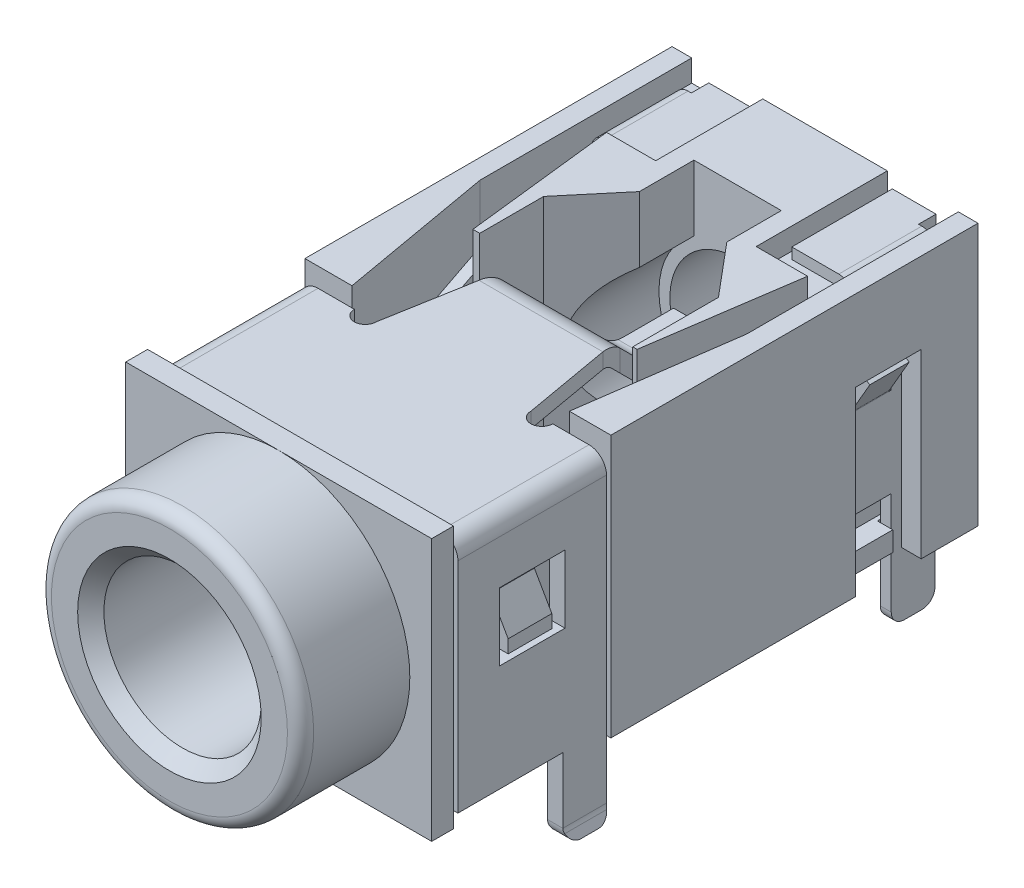
from build123d import *
from OCP.BRepAlgoAPI import BRepAlgoAPI_Cut
from OCP.TopTools import TopTools_ListOfShape

# Parameters (mm, degrees)
BOSS_EXTRUDE1_DEPTH  = 0.5
SKETCH2_W            = 6.1
SKETCH2_H            = 5.3
BOSS_EXTRUDE2_DEPTH  = 3.6
BOSS_EXTRUDE3_DEPTH  = 8.4
CUT_EXTRUDE1_DEPTH   = 0.5
CUT_EXTRUDE2_DEPTH   = 5.55
CUT_EXTRUDE3_DEPTH   = 4.15
SKETCH7_W            = 1.05
SKETCH7_H            = 0.475
SKETCH7_W_2          = 0.85
SKETCH7_H_2          = 1.15
CUT_EXTRUDE4_DEPTH   = 0.45
SKETCH8_W            = 0.85
SKETCH8_H            = 1.15
CUT_EXTRUDE5_DEPTH   = 0.95
CUT_EXTRUDE6_DEPTH   = 8.4
SKETCH10_R           = 0.475
BOSS_EXTRUDE4_DEPTH  = 0.8
FILLET1_R            = 0.2
BOSS_EXTRUDE5_DEPTH  = 1
SKETCH12_R           = 3
BOSS_EXTRUDE6_DEPTH  = 2.5
CUT_EXTRUDE7_REACH   = 17.865
SKETCH13_R           = 1.8
FILLET2_R            = 0.3
CHAMFER1_SIZE        = 0.3
BOSS_EXTRUDE7_DEPTH  = 3.4
BOSS_EXTRUDE8_DEPTH  = 1
SKETCH17_W           = 1.5
SKETCH17_H           = 1.55
CUT_EXTRUDE8_DEPTH   = 0.35
BOSS_EXTRUDE9_DEPTH  = 1.77
CUT_EXTRUDE9_DEPTH   = 3
FILLET3_R            = 0.3
SKETCH20_W           = 0.25
SKETCH20_H           = 7
BOSS_EXTRUDE10_DEPTH = 2.4
SKETCH21_W           = 1.4
SKETCH21_H           = 2.65
CUT_EXTRUDE10_DEPTH  = 0.25
BOSS_EXTRUDE11_DEPTH = 4.35
CUT_EXTRUDE11_DEPTH  = 2
BOSS_EXTRUDE12_DEPTH = 1.9
SKETCH26_W           = 1.000000003
SKETCH26_H           = 0.25
BOSS_EXTRUDE13_DEPTH = 0.4
BOSS_EXTRUDE14_DEPTH = 0.45
FILLET4_R            = 0.3
BOSS_EXTRUDE15_DEPTH = 1.6
CUT_EXTRUDE12_DEPTH  = 2.25
CUT_EXTRUDE13_DEPTH  = 2.25


with BuildPart() as part:
    # Sketch1 → Boss-Extrude1 (new body)
    with BuildSketch(Plane.XY):
        Polygon((-3.5, -3), (0, -3), (3.5, -3), (3.5, 3), (0, 3), (-3.5, 3), align=None)
    extrude(amount=-BOSS_EXTRUDE1_DEPTH)

    # Sketch2 → Boss-Extrude2 (add)
    with BuildSketch(Plane(origin=(0, 0, -0.5), x_dir=(-1, 0, 0), z_dir=(0, 0, -1))):
        with Locations((0, -0.35)):
            Rectangle(SKETCH2_W, SKETCH2_H)
    extrude(amount=BOSS_EXTRUDE2_DEPTH)

    # Sketch3 → Boss-Extrude3 (add)
    with BuildSketch(Plane(origin=(0, 0, -4.1), x_dir=(-1, 0, 0), z_dir=(0, 0, -1))):
        Polygon((-3.5, -3), (-3.05, -3), (3.05, -3), (3.5, -3), (3.5, 3), (2.55, 3), (-2.42268417, 3), (-3.5, 3), align=None)
    extrude(amount=BOSS_EXTRUDE3_DEPTH)

    # Sketch4 → Cut-Extrude1 (cut)
    with BuildSketch(Plane(origin=(0, 3, 0), x_dir=(1, 0, 0), z_dir=(0, 1, 0))):
        Polygon((2.6, 9.5), (2.6, 11.95), (2.7, 11.95), (2.7, 12.05), (3.05, 12.05), (3.05, 12.5), (1.425, 12.5), (1.425, 9.5), align=None)
        Polygon((-3.05, 12.5), (-3.05, 12.05), (-2.7, 12.05), (-2.7, 11.95), (-2.548863636, 11.95), (-2.548863636, 10.05), (-1.425, 10.05), (-1.425, 12.5), align=None)
    extrude(amount=-CUT_EXTRUDE1_DEPTH, mode=Mode.SUBTRACT)

    # Sketch5 → Cut-Extrude2 (cut)
    with BuildSketch(Plane(origin=(0, 3, 0), x_dir=(1, 0, 0), z_dir=(0, 1, 0))):
        Polygon((-2.42268417, 4.1), (-3.05, 7.657684861), (-3.05, 12.05), (-2.7, 12.05), (-2.7, 11.95), (-2.548863636, 11.95), (-2.548863636, 10.05), (-2.156818182, 6.6), (-2, 6.6), (-2, 8.061649281), (-1, 9.253402874), (-1, 10.5), (1, 10.5), (1, 9.253402874), (2, 8.061649281), (2, 6.1), (2.1, 6.1), (2.6, 9.5), (2.6, 11.95), (2.7, 11.95), (2.7, 12.05), (3.05, 12.05), (3.05, 7.657684861), (2.55, 4.1), align=None)
    extrude(amount=-CUT_EXTRUDE2_DEPTH, mode=Mode.SUBTRACT)

    # Sketch6 → Cut-Extrude3 (cut)
    with BuildSketch(Plane.XZ.offset(3)):
        Polygon((-3.05, -11.2), (-3.5, -11.2), (-3.5, -9.7), (-3.05, -9.7), (-3.05, -11), (-2.7, -11), (-2.7, -12.05), (-3.05, -12.05), align=None)
        Polygon((3.5, -11.2), (3.05, -11.2), (3.05, -12.05), (2.7, -12.05), (2.7, -11), (3.05, -11), (3.05, -9.7), (3.5, -9.7), align=None)
    extrude(amount=-CUT_EXTRUDE3_DEPTH, mode=Mode.SUBTRACT)

    # Sketch7 → Cut-Extrude4 (cut)
    with BuildSketch(Plane.XZ.offset(3)):
        with Locations((0.015, -12.2625)):
            Rectangle(SKETCH7_W, SKETCH7_H)
        with Locations((1.325, -9.1)):
            Rectangle(SKETCH7_W_2, SKETCH7_H_2)
        with Locations((-1.325, -9.1)):
            Rectangle(SKETCH7_W_2, SKETCH7_H_2)
    extrude(amount=-CUT_EXTRUDE4_DEPTH, mode=Mode.SUBTRACT)

    # Sketch8 → Cut-Extrude5 (cut)
    with BuildSketch(Plane.XZ.offset(3)):
        with Locations((1.325, -9.1)):
            Rectangle(SKETCH8_W, SKETCH8_H)
        with Locations((-1.325, -9.1)):
            Rectangle(SKETCH8_W, SKETCH8_H)
    extrude(amount=-CUT_EXTRUDE5_DEPTH, mode=Mode.SUBTRACT)

    # Sketch9 → Cut-Extrude6 (cut)
    with BuildSketch(Plane(origin=(0, 0, -12.5), x_dir=(-1, 0, 0), z_dir=(0, 0, -1))):
        with BuildLine():
            Line((1.75, -2.05), (1.75, -2.55))
            Line((1.75, -2.55), (0.54, -2.55))
            Line((0.54, -2.55), (-0.51, -2.55))
            Line((-0.51, -2.55), (-1.75, -2.55))
            Line((-1.75, -2.55), (-1.75, -2.05))
            Line((-1.75, -2.05), (-1.2, -2.05))
            Line((-1.2, -2.05), (-1.2, -1.35))
            Line((-1.2, -1.35), (-0.761577311, -1.35))
            ThreePointArc((-0.761577311, -1.35), (-1.33845897, -0.781682534), (-1.55, 0))
            ThreePointArc((-1.55, 0), (0, 1.55), (1.55, 0))
            ThreePointArc((1.55, 0), (1.33845897, -0.781682534), (0.761577311, -1.35))
            Line((0.761577311, -1.35), (1.2, -1.35))
            Line((1.2, -1.35), (1.2, -2.05))
            Line((1.2, -2.05), (1.75, -2.05))
        make_face()
    extrude(amount=-CUT_EXTRUDE6_DEPTH, mode=Mode.SUBTRACT)

    # Sketch10 → Boss-Extrude4 (add)
    with BuildSketch(Plane.XZ.offset(3)):
        with Locations(Location((0, -2, 0), (0, 0, 270))):
            Circle(SKETCH10_R)
        with Locations(Location((0, -9, 0), (0, 0, 270))):
            Circle(SKETCH10_R)
    extrude(amount=BOSS_EXTRUDE4_DEPTH)

    # Fillet1
    fillet1_edges = [part.edges().sort_by_distance(p)[0] for p in [
        (0, -3.8, -1.525),
        (0, -3.8, -8.525),
    ]]
    fillet(fillet1_edges, radius=FILLET1_R)

    # Sketch11 → Boss-Extrude5 (add)
    with BuildSketch(Plane.XY.offset(-1.8)):
        Polygon((-3.45, -0.209568124), (-3.05, -0.209568124), (-3.05, 0.790431876), (-3.45, 0.090431876), align=None)
        Polygon((3.05, -0.209568124), (3.45, -0.209568124), (3.45, 0.090431876), (3.05, 0.790431876), align=None)
    extrude(amount=-BOSS_EXTRUDE5_DEPTH)

    # Sketch12 → Boss-Extrude6 (add)
    with BuildSketch(Plane.XY):
        with Locations(Location((0, 0, 0), (0, 0, 270))):
            Circle(SKETCH12_R)
    extrude(amount=BOSS_EXTRUDE6_DEPTH)

    # Cut-Extrude7: up to this face of the body (flat: up to its plane)
    cut_extrude7_end = Plane(part.part.faces().sort_by_distance((0, 2.213607678, -10.5))[0])
    # Sketch13 → Cut-Extrude7 (cut, up to the picked face)
    with BuildSketch(Plane.XY.offset(2.5), mode=Mode.PRIVATE) as cut_extrude7_sk1:
        Circle(SKETCH13_R)
    cut_extrude7_tool1 = split(extrude(cut_extrude7_sk1.sketch, amount=-CUT_EXTRUDE7_REACH, mode=Mode.PRIVATE), bisect_by=cut_extrude7_end, keep=Keep.BOTH, mode=Mode.PRIVATE)
    add(cut_extrude7_tool1.solids().sort_by(Axis((0, 0, 2.5), (0, 0, -1)))[0], mode=Mode.SUBTRACT)

    # Fillet2
    fillet2_edges = [part.edges().sort_by_distance(p)[0] for p in [
        (0, 3, 2.5),
    ]]
    fillet(fillet2_edges, radius=FILLET2_R)

    # Chamfer1
    chamfer1_edges = [part.edges().sort_by_distance(p)[0] for p in [
        (-1.8, 0, 2.5),
    ]]
    chamfer(chamfer1_edges, length=CHAMFER1_SIZE)


with BuildPart() as body_2:
    # Sketch15 → Boss-Extrude7 (new body)
    with BuildSketch(Plane.XY.offset(-0.6)):
        with BuildLine():
            Line((-3.5, -2.439999997), (-3.5, -2.739999997))
            Line((-3.5, -2.739999997), (-3.15, -2.739999997))
            Line((-3.15, -2.739999997), (-3.15, -2.439999997))
            Line((-3.15, -2.439999997), (-3.15, 2.26))
            ThreePointArc((-3.15, 2.26), (-3.135355339, 2.295355339), (-3.1, 2.31))
            Line((-3.1, 2.31), (3.1, 2.31))
            ThreePointArc((3.1, 2.31), (3.135355339, 2.295355339), (3.15, 2.26))
            Line((3.15, 2.26), (3.15, -2.439999997))
            Line((3.15, -2.439999997), (3.15, -2.739999997))
            Line((3.15, -2.739999997), (3.5, -2.739999997))
            Line((3.5, -2.739999997), (3.5, -2.439999997))
            Line((3.5, -2.439999997), (3.5, 2.26))
            ThreePointArc((3.5, 2.26), (3.382842712, 2.542842712), (3.1, 2.66))
            Line((3.1, 2.66), (-3.1, 2.66))
            ThreePointArc((-3.1, 2.66), (-3.382842712, 2.542842712), (-3.5, 2.26))
            Line((-3.5, 2.26), (-3.5, -2.439999997))
        make_face()
    extrude(amount=-BOSS_EXTRUDE7_DEPTH)

    # Sketch16 → Boss-Extrude8 (add)
    with BuildSketch(Plane(origin=(0, 0, -4), x_dir=(-1, 0, 0), z_dir=(0, 0, -1))):
        with BuildLine():
            Line((3.15, -2.739999997), (3.15, -4.24))
            ThreePointArc((3.15, -4.24), (3.164222396, -4.369863768), (3.206215328, -4.493570957))
            Line((3.206215328, -4.493570957), (3.227865546, -4.54))
            Line((3.227865546, -4.54), (3.614047818, -4.54))
            Line((3.614047818, -4.54), (3.523423053, -4.345654565))
            ThreePointArc((3.523423053, -4.345654565), (3.505925998, -4.294109903), (3.5, -4.24))
            Line((3.5, -4.24), (3.5, -2.739999997))
            Line((3.5, -2.739999997), (3.15, -2.739999997))
        make_face()
        with BuildLine():
            Line((-3.5, -2.739999997), (-3.15, -2.739999997))
            Line((-3.15, -2.739999997), (-3.15, -4.24))
            ThreePointArc((-3.15, -4.24), (-3.164222396, -4.369863768), (-3.206215328, -4.493570957))
            Line((-3.206215328, -4.493570957), (-3.227865546, -4.54))
            Line((-3.227865546, -4.54), (-3.614047818, -4.54))
            Line((-3.614047818, -4.54), (-3.523423053, -4.345654565))
            ThreePointArc((-3.523423053, -4.345654565), (-3.505925998, -4.294109903), (-3.5, -4.24))
            Line((-3.5, -4.24), (-3.5, -2.739999997))
        make_face()
    extrude(amount=-BOSS_EXTRUDE8_DEPTH)

    # Sketch17 → Cut-Extrude8 (cut)
    with BuildSketch(Plane.ZY.offset(-3.15)):
        with Locations((-2.3, 0.475431876)):
            Rectangle(SKETCH17_W, SKETCH17_H)
    cut_extrude8 = extrude(amount=-CUT_EXTRUDE8_DEPTH, mode=Mode.SUBTRACT)

    # Mirror1: Cut-Extrude8 across plane
    add(cut_extrude8.mirror(Plane(origin=(0, 0, 0), x_dir=(0, 0, 1), z_dir=(1, 0, 0))), mode=Mode.SUBTRACT)

    # Sketch18 → Boss-Extrude9 (add, symmetric)
    with BuildSketch(Plane(origin=(0, 0, 0), x_dir=(0, 0, -1), z_dir=(1, 0, 0))):
        with BuildLine():
            Line((4, 2.66), (4, 2.31))
            Line((4, 2.31), (6, 2.31))
            ThreePointArc((6, 2.31), (6.11480503, 2.28716386), (6.212132034, 2.222132034))
            Line((6.212132034, 2.222132034), (8.079034026, 0.355230043))
            ThreePointArc((8.079034026, 0.355230043), (8.30613037, 0.203489117), (8.574008773, 0.150204789))
            Line((8.574008773, 0.150204789), (8.648412492, 0.150204789))
            Line((8.648412492, 0.150204789), (9.833988579, 0.150204789))
            Line((9.833988579, 0.150204789), (9.833988579, 0.500204789))
            Line((9.833988579, 0.500204789), (8.648412492, 0.500204789))
            Line((8.648412492, 0.500204789), (8.574008773, 0.500204789))
            ThreePointArc((8.574008773, 0.500204789), (8.440069572, 0.526846953), (8.3265214, 0.602717416))
            Line((8.3265214, 0.602717416), (6.459619408, 2.469619408))
            ThreePointArc((6.459619408, 2.469619408), (6.248744231, 2.610521696), (6, 2.66))
            Line((6, 2.66), (4, 2.66))
        make_face()
    extrude(amount=BOSS_EXTRUDE9_DEPTH, both=True)

    # Sketch19 → Cut-Extrude9 (cut)
    with BuildSketch(Plane(origin=(0, 2.66, 0), x_dir=(1, 0, 0), z_dir=(0, 1, 0))):
        with BuildLine():
            Line((-0.8, 9.833988579), (0.8, 9.833988579))
            Line((0.8, 9.833988579), (0.8, 8.648412492))
            Line((0.8, 8.648412492), (0.813119383, 8.574008773))
            add(Edge.make_bspline(
                [(0.885824999, 8.3265214), (0.861589794, 8.391313442), (0.837354588, 8.482378987), (0.813119383, 8.574008773)],
                knots=[0, 0, 0, 0, 1, 1, 1, 1], degree=3))
            Line((0.885824999, 8.3265214), (1.351363161, 6.459619408))
            add(Edge.make_bspline(
                [(1.417144432, 6), (1.411637232, 6.042739739), (1.400636535, 6.12804229), (1.384253797, 6.25033289), (1.367871058, 6.363091521), (1.356870362, 6.429397848), (1.351363161, 6.459619408)],
                knots=[0, 0, 0, 0, 0.25, 0.5, 0.75, 1, 1, 1, 1], degree=3, weights=[1, 1, 1, 1, 1, 1, 1]))
            Line((1.417144432, 6), (1.769798394, 4))
            ThreePointArc((1.769798394, 4), (1.843021699, 3.823223305), (2.019798394, 3.75))
            ThreePointArc((2.019798394, 3.75), (2.196575089, 3.823223305), (2.269798394, 4))
            Line((2.269798394, 4), (2.269798394, 10.031115329))
            Line((2.269798394, 10.031115329), (-2.269798394, 10.031115329))
            Line((-2.269798394, 10.031115329), (-2.269798394, 4))
            ThreePointArc((-2.269798394, 4), (-2.196575089, 3.823223305), (-2.019798394, 3.75))
            ThreePointArc((-2.019798394, 3.75), (-1.843021699, 3.823223305), (-1.769798394, 4))
            Line((-1.769798394, 4), (-1.417144432, 6))
            add(Edge.make_bspline(
                [(-1.351363161, 6.459619408), (-1.356870362, 6.429397848), (-1.367871058, 6.363091521), (-1.384253796, 6.250332898), (-1.400636535, 6.128042291), (-1.411637232, 6.042739739), (-1.417144432, 6)],
                knots=[0, 0, 0, 0, 0.25, 0.5, 0.75, 1, 1, 1, 1], degree=3, weights=[1, 1, 1, 1, 1, 1, 1]))
            Line((-1.351363161, 6.459619408), (-0.885824999, 8.3265214))
            add(Edge.make_bspline(
                [(-0.813119383, 8.574008773), (-0.837354589, 8.482378987), (-0.861589794, 8.391313442), (-0.885824999, 8.3265214)],
                knots=[0, 0, 0, 0, 1, 1, 1, 1], degree=3))
            Line((-0.813119383, 8.574008773), (-0.8, 8.648412493))
            Line((-0.8, 8.648412493), (-0.8, 9.833988579))
        make_face()
    extrude(amount=-CUT_EXTRUDE9_DEPTH, mode=Mode.SUBTRACT)

    # Fillet3
    fillet3_edges = [body_2.edges().sort_by_distance(p)[0] for p in [
        (-3.420956682, -4.54, -3),
        (-3.420956682, -4.54, -4),
        (3.420956682, -4.54, -3),
        (3.420956682, -4.54, -4),
    ]]
    fillet(fillet3_edges, radius=FILLET3_R)


with BuildPart() as body_3:
    # Sketch20 → Boss-Extrude10 (new body)
    with BuildSketch(Plane(origin=(0, 0, -12.04), x_dir=(-1, 0, 0), z_dir=(0, 0, -1))):
        with Locations((2.85, -1.04)):
            Rectangle(SKETCH20_W, SKETCH20_H)
    extrude(amount=-BOSS_EXTRUDE10_DEPTH)

    # Sketch21 → Cut-Extrude10 (cut)
    with BuildSketch(Plane.ZY.offset(2.975)):
        with Locations((-10.34, -3.215)):
            Rectangle(SKETCH21_W, SKETCH21_H)
        Polygon((-11.04, 0.16), (-10.99, 0.16), (-10.09, 0.16), (-10.04, 0.16), (-10.04, 1.36), (-11.04, 1.36), align=None)
    extrude(amount=-CUT_EXTRUDE10_DEPTH, mode=Mode.SUBTRACT)

    # Sketch23 → Boss-Extrude11 (add)
    with BuildSketch(Plane(origin=(0, 2.46, 0), x_dir=(1, 0, 0), z_dir=(0, 1, 0))):
        with BuildLine():
            Line((-1.539299429, 3.622167626), (-1.433644863, 3.395590679))
            ThreePointArc((-1.433644863, 3.395590679), (-1.06082018, 3.928039508), (-1.33552205, 4.51713957))
            Line((-1.33552205, 4.51713957), (-1.990843685, 4.976000719))
            ThreePointArc((-1.990843685, 4.976000719), (-2.12575119, 5.116926937), (-2.196459344, 5.298752652))
            Line((-2.196459344, 5.298752652), (-2.717403877, 8.253175911))
            add(Edge.make_bspline(
                [(-2.725, 8.34), (-2.724996883, 8.296253858), (-2.717403877, 8.253175911)],
                knots=[6.193560768, 6.193560768, 6.193560768, 6.360468763, 6.360468763, 6.360468763], degree=2, weights=[1, 0.996519736, 1]))
            Line((-2.725, 8.34), (-2.725, 9.64))
            Line((-2.725, 9.64), (-2.975, 9.64))
            Line((-2.975, 9.64), (-2.975000331, 8.34))
            ThreePointArc((-2.975000331, 8.34), (-2.972146354, 8.274633164), (-2.963606141, 8.209763809))
            Line((-2.963606141, 8.209763809), (-2.442661282, 5.255340608))
            ThreePointArc((-2.442661282, 5.255340608), (-2.336599051, 4.982602035), (-2.134237794, 4.771212708))
            Line((-2.134237794, 4.771212708), (-1.478916159, 4.312351559))
            ThreePointArc((-1.478916159, 4.312351559), (-1.309868854, 3.949828444), (-1.539299429, 3.622167626))
        make_face()
    extrude(amount=-BOSS_EXTRUDE11_DEPTH)


with BuildPart() as cut_extrude11_tool:
    # Sketch24 → Cut-Extrude11 (new body)
    with BuildSketch(Plane.ZY.offset(2.975)):
        with BuildLine():
            Line((-9.64, -1.865), (-8.34, -1.645131356))
            add(Edge.make_bspline(
                [(-8.34, -1.645131356), (-8.296363535, -1.638993311), (-8.252734953, -1.632813272), (-8.209763809, -1.626682484)],
                knots=[0, 0, 0, 0, 1, 1, 1, 1], degree=3, weights=[1, 1, 1, 1]))
            Line((-8.209763809, -1.626682484), (-5.255340608, -1.119292987))
            add(Edge.make_bspline(
                [(-5.255340608, -1.119292987), (-5.206716821, -1.112334161), (-5.111423074, -1.098442024), (-4.980034545, -1.077782308), (-4.864050984, -1.05712259), (-4.799532406, -1.043230454), (-4.771212708, -1.036271627)],
                knots=[0, 0, 0, 0, 0.25, 0.5, 0.75, 1, 1, 1, 1], degree=3, weights=[1, 1, 1, 1, 1, 1, 1]))
            Line((-4.771212708, -1.036271627), (-4.312351559, -0.900967847))
            add(Edge.make_bspline(
                [(-4.312351559, -0.900967847), (-4.294538464, -0.894073917), (-4.252968805, -0.880287533), (-4.176153608, -0.859618509), (-4.085471796, -0.838102735), (-4.019577031, -0.823478099), (-3.984708344, -0.81573723)],
                knots=[0, 0, 0, 0, 0.111111111, 0.222222222, 0.333333333, 0.458197154, 0.458197154, 0.458197154, 0.458197154], degree=3, weights=[1, 1, 1, 1, 1, 1, 1]))
            add(Edge.make_bspline(
                [(-3.395590679, -0.715), (-3.414754767, -0.721194486), (-3.461691116, -0.733577857), (-3.554480161, -0.752071346), (-3.666103348, -0.770612323), (-3.79190322, -0.789190849), (-3.900828874, -0.804275626), (-3.965610802, -0.813127834), (-3.984708344, -0.81573723)],
                knots=[0, 0, 0, 0, 0.1, 0.2, 0.3, 0.4, 0.5, 0.541821305, 0.541821305, 0.541821305, 0.541821305], degree=3, weights=[1, 1, 1, 1, 1, 1, 1, 1, 1]))
            Line((-3.395590679, -0.715), (-3.395590679, -2.13164712))
            Line((-3.395590679, -2.13164712), (-9.64, -2.13164712))
            Line((-9.64, -2.13164712), (-9.64, -1.865))
        make_face()
        with BuildLine():
            Line((-4.312351559, 1.051823432), (-4.771212708, 1.245954944))
            add(Edge.make_bspline(
                [(-4.771212708, 1.245954944), (-4.799534057, 1.255939929), (-4.864054629, 1.275872465), (-4.980034748, 1.305513742), (-5.111418529, 1.335155026), (-5.206713986, 1.355087562), (-5.255340608, 1.365072547)],
                knots=[0, 0, 0, 0, 0.25, 0.5, 0.75, 1, 1, 1, 1], degree=3, weights=[1, 1, 1, 1, 1, 1, 1]))
            Line((-5.255340608, 1.365072547), (-8.209763809, 2.093065715))
            add(Edge.make_bspline(
                [(-8.209763809, 2.093065715), (-8.252740577, 2.101873142), (-8.296365133, 2.110739317), (-8.34, 2.119535836)],
                knots=[0, 0, 0, 0, 1, 1, 1, 1], degree=3, weights=[1, 1, 1, 1]))
            Line((-8.34, 2.119535836), (-9.64, 2.435))
            Line((-9.64, 2.435), (-9.64, 2.652707983))
            Line((-9.64, 2.652707983), (-3.395590679, 2.652707983))
            Line((-3.395590679, 2.652707983), (-3.395590679, 0.785))
            add(Edge.make_bspline(
                [(-3.395590679, 0.785), (-3.414350679, 0.793700337), (-3.46030325, 0.811175631), (-3.552305394, 0.837617667), (-3.663776984, 0.864287116), (-3.79033686, 0.891135316), (-3.899906729, 0.912910713), (-3.965314558, 0.925733149), (-3.984697982, 0.929532802)],
                knots=[0, 0, 0, 0, 0.1, 0.2, 0.3, 0.4, 0.5, 0.542086432, 0.542086432, 0.542086432, 0.542086432], degree=3, weights=[1, 1, 1, 1, 1, 1, 1, 1, 1]))
            add(Edge.make_bspline(
                [(-3.984697982, 0.929532802), (-3.98856391, 0.930764171), (-4.023455478, 0.941877525), (-4.089094781, 0.962858211), (-4.176221015, 0.992521295), (-4.252958617, 1.022148341), (-4.294535488, 1.041930489), (-4.312351559, 1.051823432)],
                knots=[0.541711188, 0.541711188, 0.541711188, 0.541711188, 0.555555556, 0.666666667, 0.777777778, 0.888888889, 1, 1, 1, 1], degree=3, weights=[1, 1, 1, 1, 1, 1, 1, 1]))
        make_face()
    extrude(amount=-CUT_EXTRUDE11_DEPTH)


with BuildPart() as body_3_1:
    add(body_3.part)

    # Cut-Extrude11: cut by cut_extrude11_tool, with a tolerance
    cut_extrude11_stock = TopTools_ListOfShape()
    cut_extrude11_stock.Append(body_3_1.part.wrapped)
    cut_extrude11_tools = TopTools_ListOfShape()
    cut_extrude11_tools.Append(cut_extrude11_tool.part.wrapped)
    cut_extrude11_cut = BRepAlgoAPI_Cut()
    cut_extrude11_cut.SetArguments(cut_extrude11_stock)
    cut_extrude11_cut.SetTools(cut_extrude11_tools)
    cut_extrude11_cut.SetFuzzyValue(0.00001)
    cut_extrude11_cut.Build()
    add(Compound.cast(cut_extrude11_cut.Shape()).solids(), mode=Mode.REPLACE)

    # Sketch25 → Boss-Extrude12 (add)
    with BuildSketch(Plane(origin=(0, 0, -12.04), x_dir=(-1, 0, 0), z_dir=(0, 0, -1))):
        with BuildLine():
            Line((2.599999999, 2.76), (1.599999996, 2.76))
            Line((1.599999996, 2.76), (1.599999996, 2.51))
            Line((1.599999996, 2.51), (2.599999999, 2.51))
            Line((2.599999999, 2.51), (2.675, 2.51))
            ThreePointArc((2.675, 2.51), (2.710355339, 2.495355339), (2.725, 2.46))
            Line((2.725, 2.46), (2.975, 2.46))
            ThreePointArc((2.975, 2.46), (2.887132034, 2.672132034), (2.675, 2.76))
            Line((2.675, 2.76), (2.599999999, 2.76))
        make_face()
    extrude(amount=-BOSS_EXTRUDE12_DEPTH)

    # Sketch26 → Boss-Extrude13 (add)
    with BuildSketch(Plane(origin=(0, 0, -12.04), x_dir=(-1, 0, 0), z_dir=(0, 0, -1))):
        with Locations((2.099999998, 2.635)):
            Rectangle(SKETCH26_W, SKETCH26_H)
    extrude(amount=BOSS_EXTRUDE13_DEPTH)

    # Sketch27 → Boss-Extrude14 (add, symmetric)
    with BuildSketch(Plane(origin=(0, 0, -10.54), x_dir=(-1, 0, 0), z_dir=(0, 0, -1))):
        with BuildLine():
            Line((3.435883837, 0.971671682), (2.98169873, 0.185))
            ThreePointArc((2.98169873, 0.185), (2.976703709, 0.172940952), (2.975, 0.16))
            Line((2.975, 0.16), (2.725, 0.16))
            ThreePointArc((2.725, 0.16), (2.735222252, 0.237645714), (2.765192379, 0.31))
            Line((2.765192379, 0.31), (3.219377486, 1.096671682))
            Line((3.219377486, 1.096671682), (3.435883837, 0.971671682))
        make_face()
    extrude(amount=BOSS_EXTRUDE14_DEPTH, both=True)

    # Fillet4
    fillet4_edges = [body_3_1.edges().sort_by_distance(p)[0] for p in [
        (-2.85, -4.54, -11.04),
        (-2.85, -4.54, -12.04),
    ]]
    fillet(fillet4_edges, radius=FILLET4_R)


with BuildPart() as body_4:
    # Mirror2: mirrored copy
    add(body_3_1.part.mirror(Plane(origin=(0, 0, 0), x_dir=(0, 0, 1), z_dir=(1, 0, 0))))


with BuildPart() as body_5:
    # Sketch28 → Boss-Extrude15 (new, symmetric)
    with BuildSketch(Plane(origin=(0, 0, 0), x_dir=(0, 0, -1), z_dir=(1, 0, 0))):
        with BuildLine():
            Line((12.175, -4.54), (12.175, -2.59))
            ThreePointArc((12.175, -2.59), (12.160355339, -2.554644661), (12.125, -2.54))
            Line((12.125, -2.54), (9.525, -2.54))
            Line((9.525, -2.54), (8.425, -2.54))
            Line((8.425, -2.54), (7.425, -2.539999511))
            ThreePointArc((7.425, -2.539999511), (7.329493587, -2.531643783), (7.236889088, -2.506830482))
            Line((7.236889088, -2.506830482), (4.251817164, -1.420353675))
            Line((4.251817164, -1.420353675), (2.593250665, -0.816684837))
            ThreePointArc((2.593250665, -0.816684837), (2.210931464, -0.833377254), (1.952394284, -1.115521073))
            Line((1.952394284, -1.115521073), (1.717471129, -1.030016036))
            ThreePointArc((1.717471129, -1.030016036), (2.105276899, -0.606800306), (2.678755701, -0.581761682))
            Line((2.678755701, -0.581761682), (4.337322199, -1.185430519))
            Line((4.337322199, -1.185430519), (7.322393957, -2.271907786))
            ThreePointArc((7.322393957, -2.271907786), (7.372905547, -2.285442326), (7.425, -2.29))
            Line((7.425, -2.29), (8.425, -2.29))
            Line((8.425, -2.29), (9.525, -2.29))
            Line((9.525, -2.29), (12.125, -2.29))
            ThreePointArc((12.125, -2.29), (12.337132034, -2.377867966), (12.425, -2.59))
            Line((12.425, -2.59), (12.425, -4.54))
            Line((12.425, -4.54), (12.175, -4.54))
        make_face()
    extrude(amount=BOSS_EXTRUDE15_DEPTH, both=True)

    # Sketch29 → Cut-Extrude12 (cut)
    with BuildSketch(Plane(origin=(0, -2.29, 0), x_dir=(1, 0, 0), z_dir=(0, 1, 0))):
        with BuildLine():
            Line((0.9, 12.125), (1.6, 12.125))
            Line((1.6, 12.125), (1.6, 12.425))
            Line((1.6, 12.425), (0.5, 12.425))
            Line((0.5, 12.425), (0.5, 12.125))
            ThreePointArc((0.5, 12.125), (0.558578644, 11.983578644), (0.7, 11.925))
            ThreePointArc((0.7, 11.925), (0.841421356, 11.983578644), (0.9, 12.125))
        make_face()
        with BuildLine():
            Line((-1.6, 12.125), (-0.9, 12.125))
            ThreePointArc((-0.9, 12.125), (-0.841421356, 11.983578644), (-0.7, 11.925))
            ThreePointArc((-0.7, 11.925), (-0.558578644, 11.983578644), (-0.5, 12.125))
            Line((-0.5, 12.125), (-0.5, 12.425))
            Line((-0.5, 12.425), (-1.6, 12.425))
            Line((-1.6, 12.425), (-1.6, 12.125))
        make_face()
        Polygon((1, 9.525), (0.9, 9.525), (0.9, 8.425), (1.6, 8.425), (1.6, 9.525), align=None)
        Polygon((-1.6, 8.425), (-0.9, 8.425), (-0.9, 9.525), (-1, 9.525), (-1.6, 9.525), align=None)
    extrude(amount=-CUT_EXTRUDE12_DEPTH, mode=Mode.SUBTRACT)

    # Sketch30 → Cut-Extrude13 (cut)
    with BuildSketch(Plane.XZ.offset(2.54)):
        with BuildLine():
            Line((0.837385808, -1.717471129), (-0.837385808, -1.717471129))
            Line((-0.837385808, -1.717471129), (-0.837385808, -2.678755701))
            Line((-0.837385808, -2.678755701), (-0.837385808, -4.337322199))
            Line((-0.837385808, -4.337322199), (-1.397514385, -7.322393957))
            add(Edge.make_bspline(
                [(-1.397514385, -7.322393957), (-1.406237104, -7.355207358), (-1.4149503, -7.390080708), (-1.423673019, -7.425)],
                knots=[0, 0, 0, 0, 1, 1, 1, 1], degree=3, weights=[1, 1, 1, 1]))
            Line((-1.423673019, -7.425), (-1.6, -8.425))
            Line((-1.6, -8.425), (-1.908074467, -8.425))
            Line((-1.908074467, -8.425), (-1.908074467, -1.532805606))
            Line((-1.908074467, -1.532805606), (1.875897313, -1.532805606))
            Line((1.875897313, -1.532805606), (2.032836235, -8.425))
            Line((2.032836235, -8.425), (1.6, -8.425))
            Line((1.6, -8.425), (1.423673019, -7.425))
            add(Edge.make_bspline(
                [(1.423673019, -7.425), (1.4149503, -7.390080708), (1.406237104, -7.355207358), (1.397514385, -7.322393957)],
                knots=[0, 0, 0, 0, 1, 1, 1, 1], degree=3, weights=[1, 1, 1, 1]))
            Line((1.397514385, -7.322393957), (0.837385808, -4.337322199))
            Line((0.837385808, -4.337322199), (0.837385808, -2.678755701))
            Line((0.837385808, -2.678755701), (0.837385808, -1.717471129))
        make_face()
    extrude(amount=-CUT_EXTRUDE13_DEPTH, mode=Mode.SUBTRACT)


solid = Compound([part.part, body_2.part, body_3_1.part, body_4.part, body_5.part])
